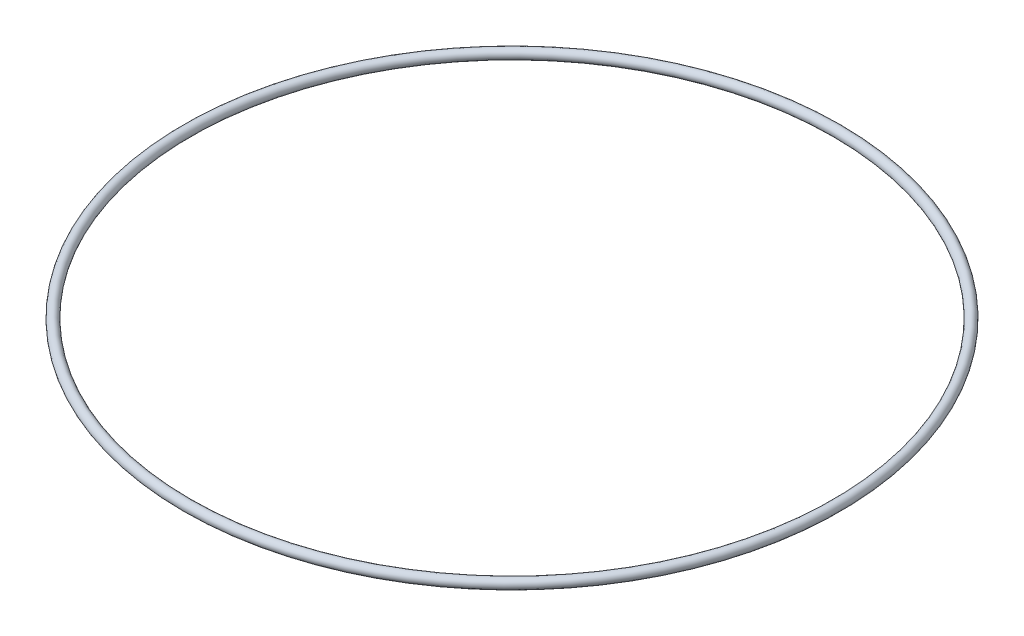
from build123d import *

# Parameters (mm, degrees)
SKETCH1_R = 1


with BuildPart() as part:
    # Sketch1 → Revolve1 (revolve)
    with BuildSketch(Plane.XY):
        with Locations((-66, 0)):
            Circle(SKETCH1_R)
    revolve(axis=Axis((0, 0, 0), (0, 1, 0)))


solid = part.part
